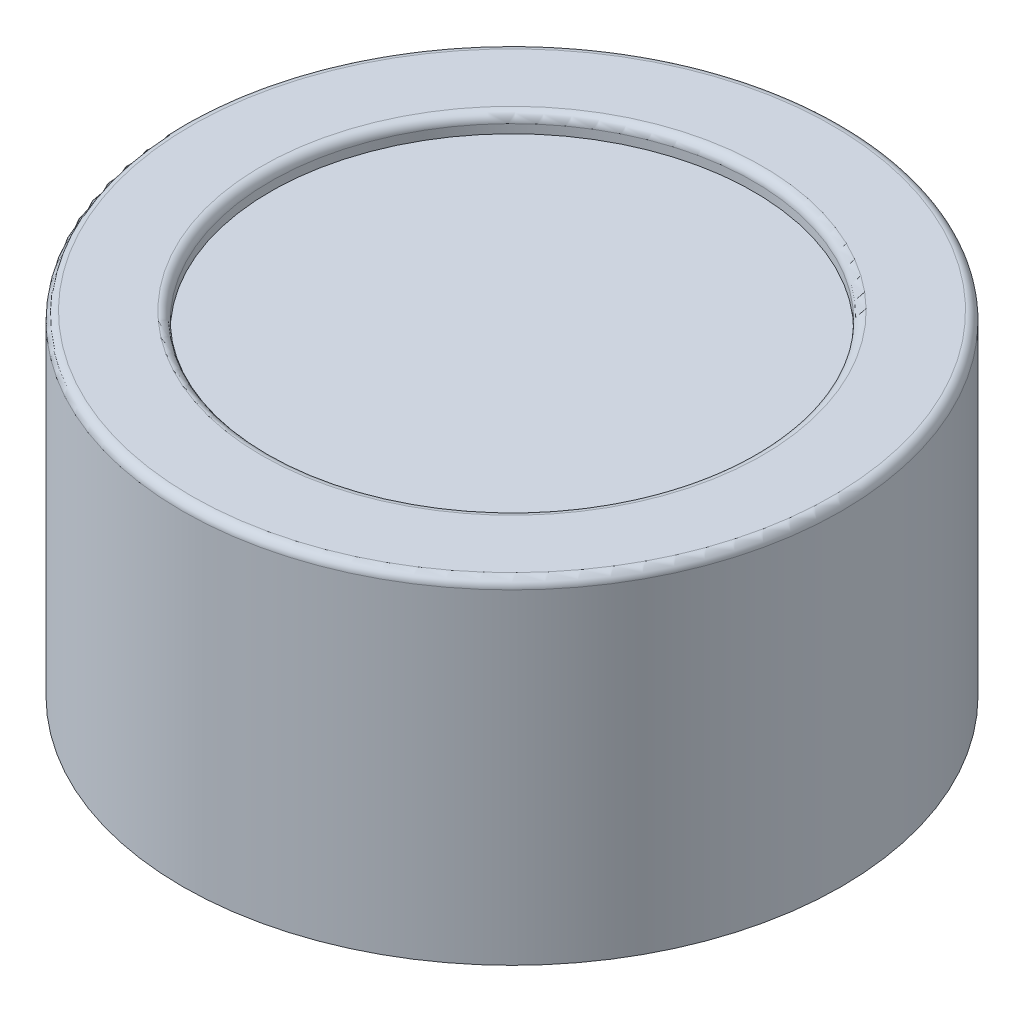
from build123d import *

# Parameters (mm, degrees)
SKETCH1_R           = 18.75
BOSS_EXTRUDE1_DEPTH = 19
SKETCH2_4_R         = 13.75
CUT_EXTRUDE2_DEPTH  = 1
FILLET1_R           = 0.5


with BuildPart() as part:
    # Sketch1 → Boss-Extrude1 (new body)
    with BuildSketch(Plane(origin=(0, 0, 0), x_dir=(1, 0, 0), z_dir=(0, 1, 0))):
        Circle(SKETCH1_R)
    extrude(amount=BOSS_EXTRUDE1_DEPTH)

    # Sketch2<4> → Cut-Extrude2 (cut)
    with BuildSketch(Plane(origin=(0, 19, 0), x_dir=(1, 0, 0), z_dir=(0, 1, 0))):
        Circle(SKETCH2_4_R)
    extrude(amount=-CUT_EXTRUDE2_DEPTH, mode=Mode.SUBTRACT)

    # Fillet1
    fillet1_edges = [part.edges().sort_by_distance(p)[0] for p in [
        (-18.75, 19, 0),
        (-13.75, 19, 0),
    ]]
    fillet(fillet1_edges, radius=FILLET1_R)


solid = part.part
